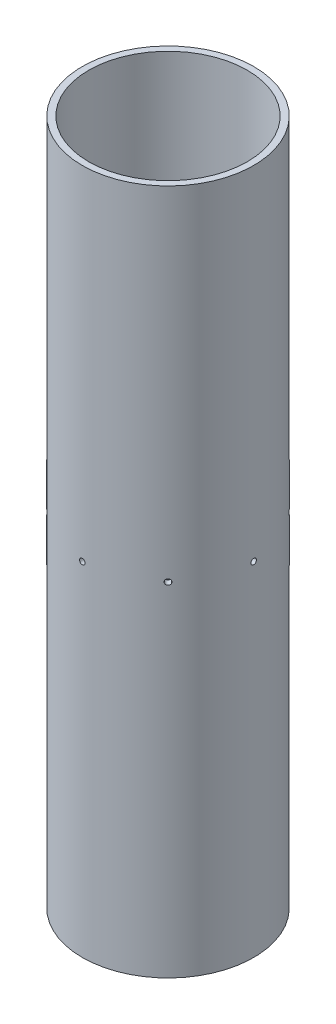
from build123d import *

# Parameters (mm, degrees)
SKETCH1_R               = 50.8
SKETCH1_R_2             = 46.99
COUPLER_EXTRUSION_DEPTH = 406.4
BULKHEAD_HOLE_REACH     = 423.976
SKETCH2_R               = 1.6383
CIRPATTERN1_COUNT       = 8


with BuildPart() as part:
    # Sketch1 → Coupler Extrusion (new body)
    with BuildSketch(Plane(origin=(0, 0, 0), x_dir=(1, 0, 0), z_dir=(0, 1, 0))):
        Circle(SKETCH1_R)
        Circle(SKETCH1_R_2, mode=Mode.SUBTRACT)
    extrude(amount=COUPLER_EXTRUSION_DEPTH)

    # Sketch2 → Bulkhead Hole (cut, up to next)
    with BuildSketch(Plane.XY.offset(50.8), mode=Mode.PRIVATE) as bulkhead_hole_sk1:
        with Locations((0, 203.2)):
            Circle(SKETCH2_R)
    bulkhead_hole_tool1 = extrude(bulkhead_hole_sk1.sketch, amount=-BULKHEAD_HOLE_REACH, mode=Mode.PRIVATE) & part.part
    bulkhead_hole = bulkhead_hole_tool1.solids().sort_by_distance((0, 203.2, 50.8))[0]
    add(bulkhead_hole, mode=Mode.SUBTRACT)

    # CirPattern1: Bulkhead Hole ×8 about axis
    cirpattern1_axis = Axis((0, 406.4, 0), (0, -1, 0))
    for i in range(1, CIRPATTERN1_COUNT):
        add(bulkhead_hole.rotate(cirpattern1_axis, i * 360 / CIRPATTERN1_COUNT), mode=Mode.SUBTRACT)


solid = part.part
